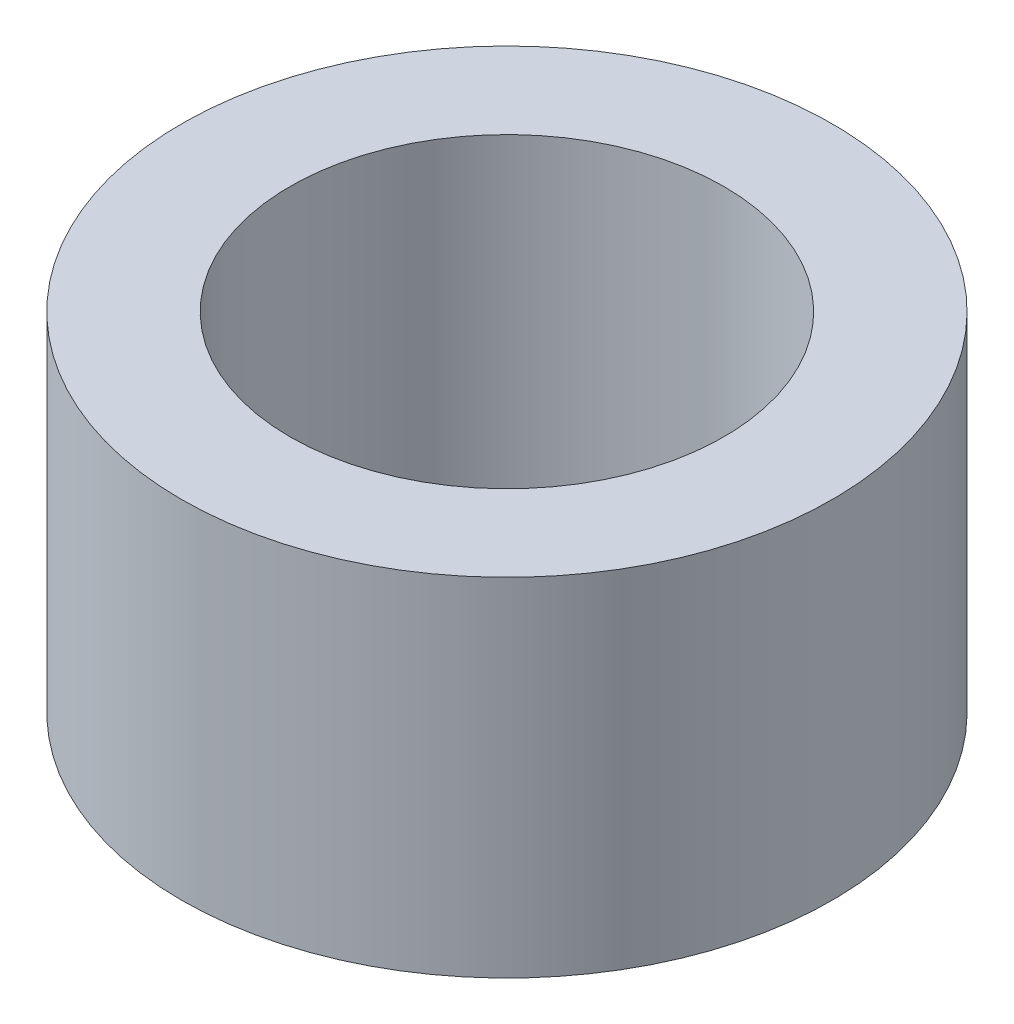
from build123d import *

# Parameters (mm, degrees)
SKETCH1_R           = 7.5
BOSS_EXTRUDE1_DEPTH = 4
SKETCH2_R           = 5
CUT_EXTRUDE1_DEPTH  = 10
SKETCH3_R           = 7.5
SKETCH3_R_2         = 5
BOSS_EXTRUDE2_DEPTH = 4


with BuildPart() as part:
    # Sketch1 → Boss-Extrude1 (new body)
    with BuildSketch(Plane(origin=(0, 0, 0), x_dir=(1, 0, 0), z_dir=(0, 1, 0))):
        Circle(SKETCH1_R)
    extrude(amount=BOSS_EXTRUDE1_DEPTH)

    # Sketch2 → Cut-Extrude1 (cut)
    with BuildSketch(Plane(origin=(0, 4, 0), x_dir=(1, 0, 0), z_dir=(0, 1, 0))):
        Circle(SKETCH2_R)
    extrude(amount=-CUT_EXTRUDE1_DEPTH, mode=Mode.SUBTRACT)

    # Sketch3 → Boss-Extrude2 (add)
    with BuildSketch(Plane(origin=(0, 4, 0), x_dir=(1, 0, 0), z_dir=(0, 1, 0))):
        Circle(SKETCH3_R)
        Circle(SKETCH3_R_2, mode=Mode.SUBTRACT)
    extrude(amount=BOSS_EXTRUDE2_DEPTH)


solid = part.part
